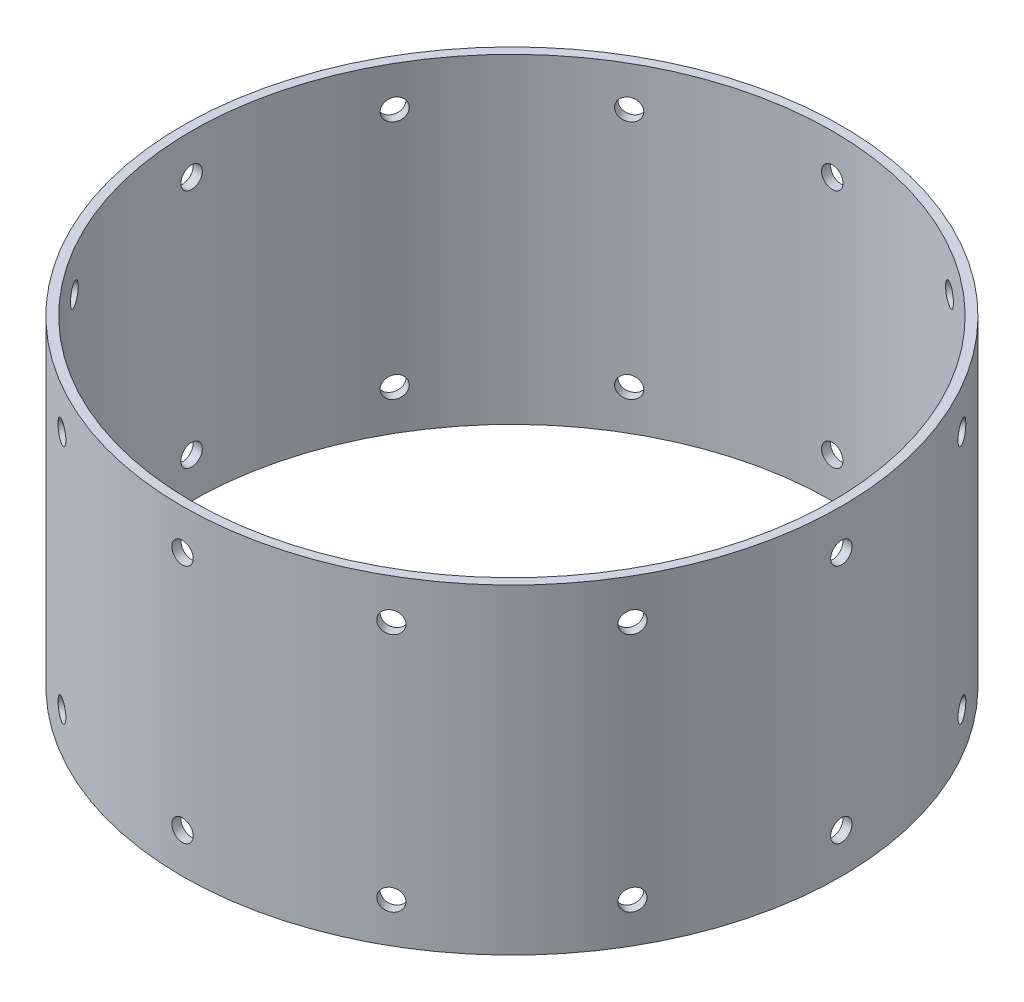
from build123d import *

# Parameters (mm, degrees)
SKETCH1_R           = 78.359
SKETCH1_R_2         = 76.2
BOSS_EXTRUDE1_DEPTH = 76.2
SKETCH2_R           = 2.54
CUT_EXTRUDE1_DEPTH  = 135.486823749
CIRPATTERN1_COUNT   = 12


with BuildPart() as part:
    # Sketch1 → Boss-Extrude1 (new body)
    with BuildSketch(Plane(origin=(0, 0, 0), x_dir=(1, 0, 0), z_dir=(0, 1, 0))):
        Circle(SKETCH1_R)
        Circle(SKETCH1_R_2, mode=Mode.SUBTRACT)
    extrude(amount=BOSS_EXTRUDE1_DEPTH)

    # Sketch2 → Cut-Extrude1 (cut, through all)
    with BuildSketch(Plane.XY):
        with Locations((0, 9.525)):
            Circle(SKETCH2_R)
        with Locations((0, 66.675)):
            Circle(SKETCH2_R)
    cut_extrude1 = extrude(amount=-CUT_EXTRUDE1_DEPTH, mode=Mode.SUBTRACT)

    # CirPattern1: Cut-Extrude1 ×12 about axis
    cirpattern1_axis = Axis((0, 0, 0), (0, 1, 0))
    for i in range(1, CIRPATTERN1_COUNT):
        add(cut_extrude1.rotate(cirpattern1_axis, i * 360 / CIRPATTERN1_COUNT), mode=Mode.SUBTRACT)


solid = part.part
